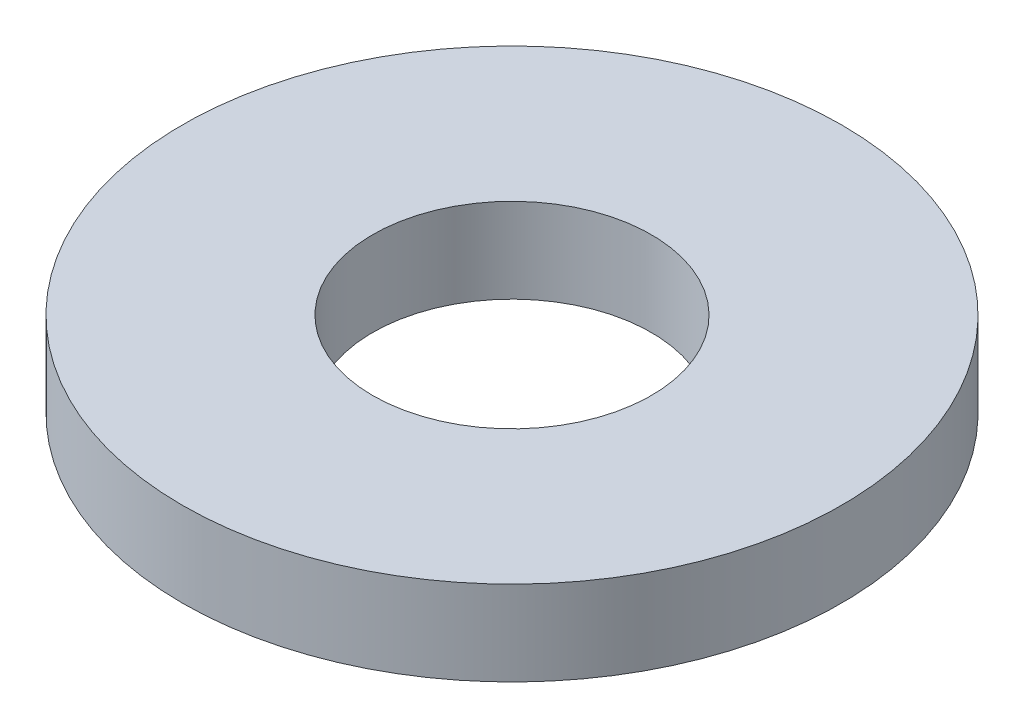
from build123d import *

# Parameters (mm, degrees)
SKETCH_2_R      = 35
SKETCH_2_R_2    = 14.8
EXTRUDE_1_DEPTH = 9


with BuildPart() as part:
    # Эскиз2 → Вытянуть1 (new body)
    with BuildSketch(Plane(origin=(0, 0, 0), x_dir=(1, 0, 0), z_dir=(0, 1, 0))):
        Circle(SKETCH_2_R)
        Circle(SKETCH_2_R_2, mode=Mode.SUBTRACT)
    extrude(amount=EXTRUDE_1_DEPTH)


solid = part.part
